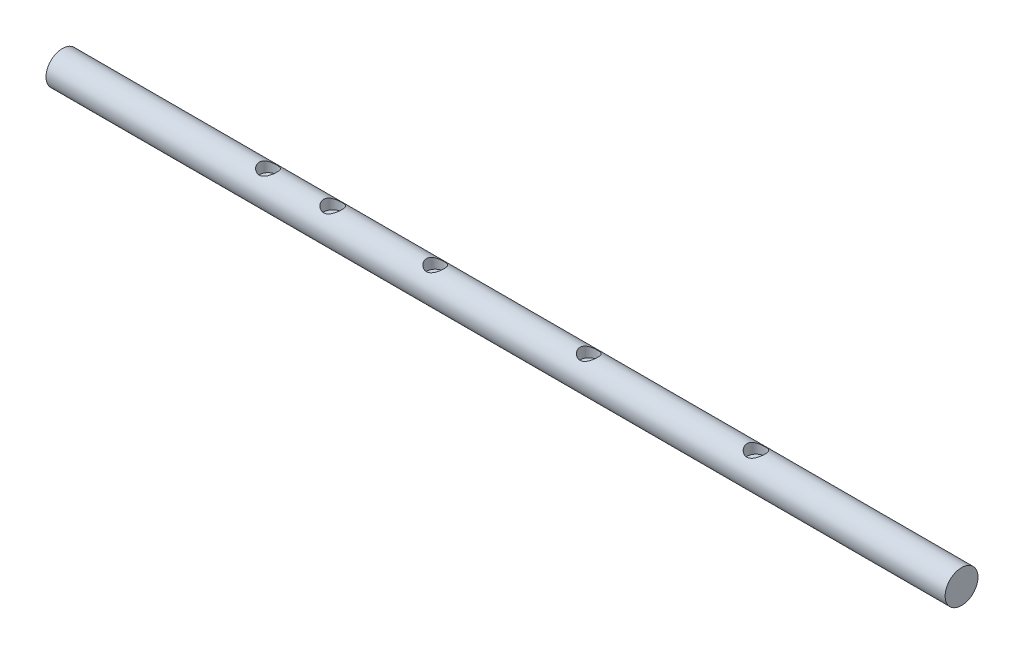
from build123d import *

# Parameters (mm, degrees)
SKETCH1_W          = 164
SKETCH1_H          = 3
SKETCH3_R          = 1.6
SKETCH3_R_2        = 1.65
CUT_EXTRUDE3_DEPTH = 2


with BuildPart() as part:
    # Sketch1 → Revolve1 (revolve)
    with BuildSketch(Plane.XY):
        with Locations((-65.615874943, -0.340909091)):
            Rectangle(SKETCH1_W, SKETCH1_H)
    revolve(axis=Axis((-147.615874943, 1.159090909, 0), (1, 0, 0)))

    # Sketch3 → Cut-Extrude3 (cut)
    with BuildSketch(Plane(origin=(16.384125057, 4.159090909, 0), x_dir=(1, 0, 0), z_dir=(0, 1, 0))):
        with Locations((-126.5, 0)):
            Circle(SKETCH3_R)
        with Locations((-114.7, 0)):
            Circle(SKETCH3_R_2)
        with Locations((-37.5, 0)):
            Circle(SKETCH3_R_2)
        with Locations((-96, 0)):
            Circle(SKETCH3_R)
        with Locations((-68, 0)):
            Circle(SKETCH3_R)
    extrude(amount=-CUT_EXTRUDE3_DEPTH, mode=Mode.SUBTRACT)


solid = part.part
